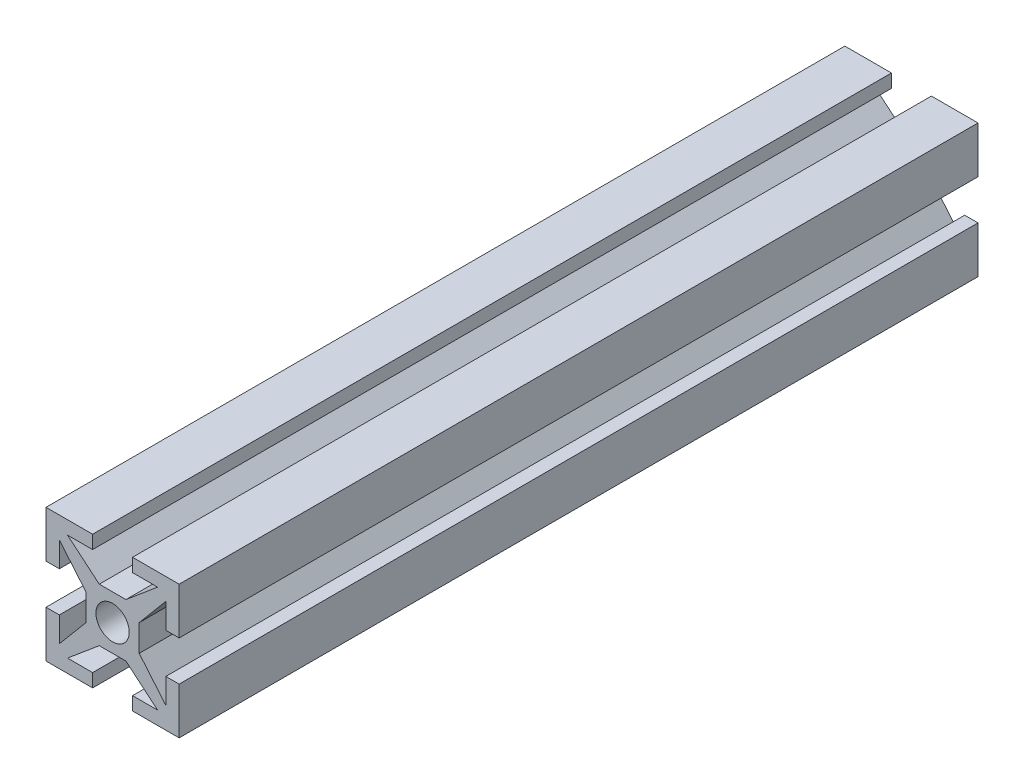
from build123d import *

# Parameters (mm, degrees)
ESQUISSE2_R          = 1.25
MAIN_EXTRUSION_DEPTH = 60


with BuildPart() as part:
    # Esquisse2 → Main Extrusion (new body)
    with BuildSketch(Plane.XY):
        Polygon((-1, -2), (1, -2), (3.383507185, -4), (1.5, -4), (1.5, -5), (5, -5), (5, -1.5), (4, -1.5), (4, -3.383507185), (2, -1), (2, 1), (4, 3.383507185), (4, 1.5), (5, 1.5), (5, 5), (1.5, 5), (1.5, 4), (3.383507185, 4), (1, 2), (-1, 2), (-3.383507185, 4), (-1.5, 4), (-1.5, 5), (-5, 5), (-5, 1.5), (-4, 1.5), (-4, 3.383507185), (-2, 1), (-2, -1), (-4, -3.383507185), (-4, -1.5), (-5, -1.5), (-5, -5), (-1.5, -5), (-1.5, -4), (-3.383507185, -4), align=None)
        Circle(ESQUISSE2_R, mode=Mode.SUBTRACT)
    extrude(amount=MAIN_EXTRUSION_DEPTH)


solid = part.part
